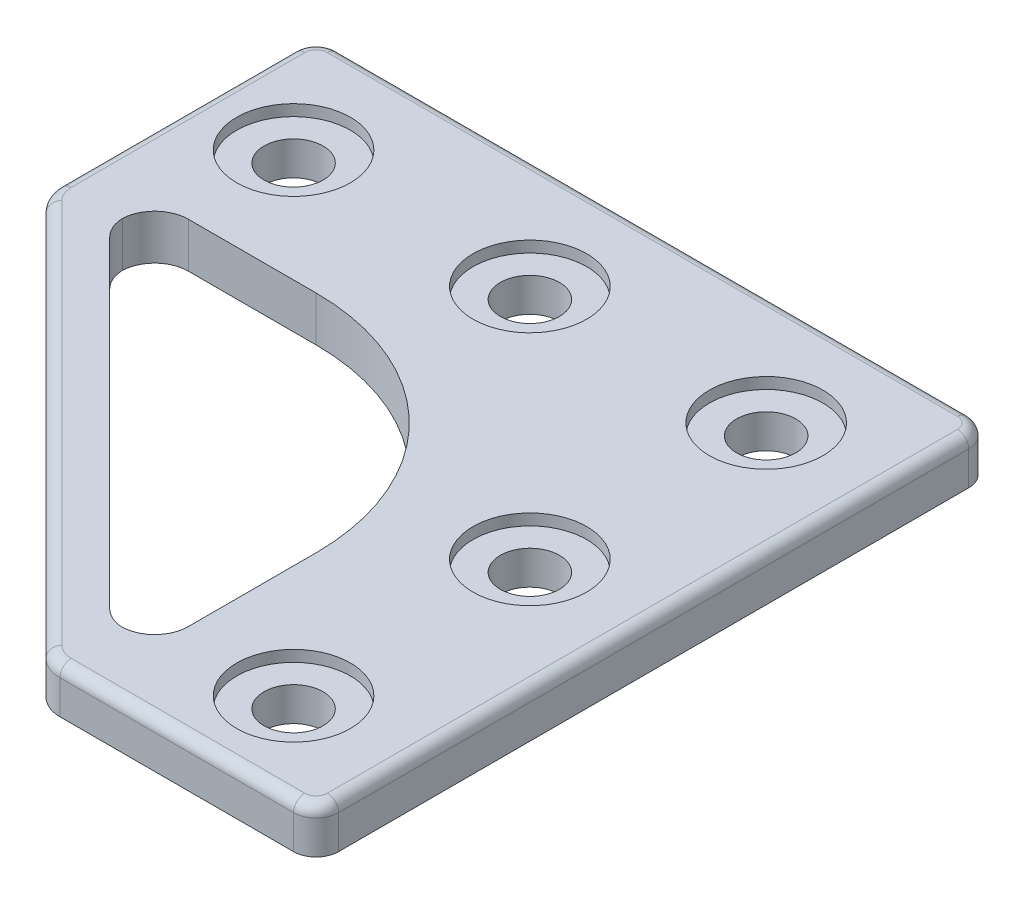
from build123d import *

# Parameters (mm, degrees)
SKETCH1_R           = 2.625
BOSS_EXTRUDE1_DEPTH = 4
FILLET1_R           = 20
FILLET2_R           = 3
SKETCH2_R           = 5.05
CUT_EXTRUDE1_DEPTH  = 1
FILLET3_R           = 1


with BuildPart() as part:
    # Sketch1 → Boss-Extrude1 (new body)
    with BuildSketch(Plane(origin=(0, 0, 0), x_dir=(1, 0, 0), z_dir=(0, 1, 0))):
        with BuildLine():
            Line((2, -40), (18, -40))
            ThreePointArc((18, -40), (19.414213562, -39.414213562), (20, -38))
            Line((20, -38), (20, -10.175438596))
            Line((20, -10.175438596), (20, 18))
            ThreePointArc((20, 18), (19.414213562, 19.414213562), (18, 20))
            Line((18, 20), (-38, 20))
            ThreePointArc((-38, 20), (-39.414213562, 19.414213562), (-40, 18))
            Line((-40, 18), (-40, 2))
            Line((-40, 2), (-40, -4))
            Line((-40, -4), (-4, -40))
            Line((-4, -40), (2, -40))
        make_face()
        with Locations(Location((-32, 10, 0), (0, 0, 270))):
            Circle(SKETCH1_R, mode=Mode.SUBTRACT)
        with Locations(Location((-11, 10, 0), (0, 0, 270))):
            Circle(SKETCH1_R, mode=Mode.SUBTRACT)
        with Locations(Location((10, -32, 0), (0, 0, 270))):
            Circle(SKETCH1_R, mode=Mode.SUBTRACT)
        with Locations(Location((10, 10, 0), (0, 0, 270))):
            Circle(SKETCH1_R, mode=Mode.SUBTRACT)
        with Locations(Location((10, -11, 0), (0, 0, 270))):
            Circle(SKETCH1_R, mode=Mode.SUBTRACT)
        Polygon((0, 0), (0, -34.343145751), (-4, -34.343145751), (-34.343145751, -4), (-34.343145751, 0), align=None, mode=Mode.SUBTRACT)
    extrude(amount=BOSS_EXTRUDE1_DEPTH)

    # Fillet1
    fillet1_edges = [part.edges().sort_by_distance(p)[0] for p in [
        (0, 2, 0),
    ]]
    fillet(fillet1_edges, radius=FILLET1_R)

    # Fillet2
    # the kernel refuses this fillet: 3 mm, written as the material it adds along each edge
    with BuildSketch(Plane(origin=(-4, 0, 34.343145751), x_dir=(1, 0, 0), z_dir=(0, 1, 0)), Plane(origin=(-34.343145751, 0, 4), x_dir=(0.7071067811865454, 0, 0.7071067811865497), z_dir=(0, 1, 0))) as fillet2_piece_1:
        with BuildLine():
            CenterArc((FILLET2_R * 0.414213562373, FILLET2_R), FILLET2_R, 225, 45)
            Line((-FILLET2_R * 0.292893218813, FILLET2_R * 0.292893218813), (0, 0))
            Line((0, 0), (FILLET2_R * 0.414213562373, 0))
        make_face()
    extrude(amount=4)
    with BuildSketch(Plane(origin=(0, 0, 34.343145751), x_dir=(0, 0, -1), z_dir=(0, 1, 0))) as fillet2_piece_2:
        with BuildLine():
            CenterArc((FILLET2_R, FILLET2_R), FILLET2_R, 180, 90)
            Line((0, FILLET2_R), (0, 0))
            Line((0, 0), (FILLET2_R, 0))
        make_face()
    extrude(amount=4)
    with BuildSketch(Plane(origin=(-34.343145751, 0, 0), x_dir=(1, 0, 0), z_dir=(0, 1, 0))) as fillet2_piece_3:
        with BuildLine():
            CenterArc((FILLET2_R, -FILLET2_R), FILLET2_R, 90, 90)
            Line((0, -FILLET2_R), (0, 0))
            Line((0, 0), (FILLET2_R, 0))
        make_face()
    extrude(amount=4)
    # the kernel refuses this fillet: 3 mm, written as the material it takes off along each edge
    with BuildSketch(Plane(origin=(-40, -3.106601718, 4), x_dir=(0, 0, -1), z_dir=(0, 1, 0))) as fillet2_2_piece_1:
        with BuildLine():
            CenterArc((FILLET2_R * 0.414213562373, -FILLET2_R), FILLET2_R, 90, 45)
            Line((-FILLET2_R * 0.292893218813, -FILLET2_R * 0.292893218813), (0, 0))
            Line((0, 0), (FILLET2_R * 0.414213562373, 0))
        make_face()
    extrude(amount=10.213203436, mode=Mode.SUBTRACT)
    with BuildSketch(Plane(origin=(-4, -3.106601718, 40), x_dir=(1, 0, 0), z_dir=(0, 1, 0))) as fillet2_2_piece_2:
        with BuildLine():
            CenterArc((FILLET2_R * 0.414213562373, FILLET2_R), FILLET2_R, 225, 45)
            Line((-FILLET2_R * 0.292893218813, FILLET2_R * 0.292893218813), (0, 0))
            Line((0, 0), (FILLET2_R * 0.414213562373, 0))
        make_face()
    extrude(amount=10.213203436, mode=Mode.SUBTRACT)

    # Sketch2 → Cut-Extrude1 (cut)
    with BuildSketch(Plane(origin=(0, 4, 0), x_dir=(1, 0, 0), z_dir=(0, 1, 0))):
        with Locations(Location((-32, 10, 0), (0, 0, 270))):
            Circle(SKETCH2_R)
        with Locations(Location((-11, 10, 0), (0, 0, 270))):
            Circle(SKETCH2_R)
        with Locations(Location((10, 10, 0), (0, 0, 270))):
            Circle(SKETCH2_R)
        with Locations(Location((10, -11, 0), (0, 0, 270))):
            Circle(SKETCH2_R)
        with Locations(Location((10, -32, 0), (0, 0, 270))):
            Circle(SKETCH2_R)
    extrude(amount=-CUT_EXTRUDE1_DEPTH, mode=Mode.SUBTRACT)

    # Fillet3
    fillet3_edges = [part.edges().sort_by_distance(p)[0] for p in [
        (-10, 4, -20),
        (-39.414213562, 4, -19.414213562),
        (-40, 4, -7.621320344),
        (19.414213562, 4, 39.414213562),
        (20, 4, 10),
        (-22, 4, 22),
        (7.621320344, 4, 40),
        (-3.90540961, 4, 39.771638598),
        (-39.771638598, 4, 3.90540961),
        (19.414213562, 4, -19.414213562),
    ]]
    fillet(fillet3_edges, radius=FILLET3_R)


solid = part.part
